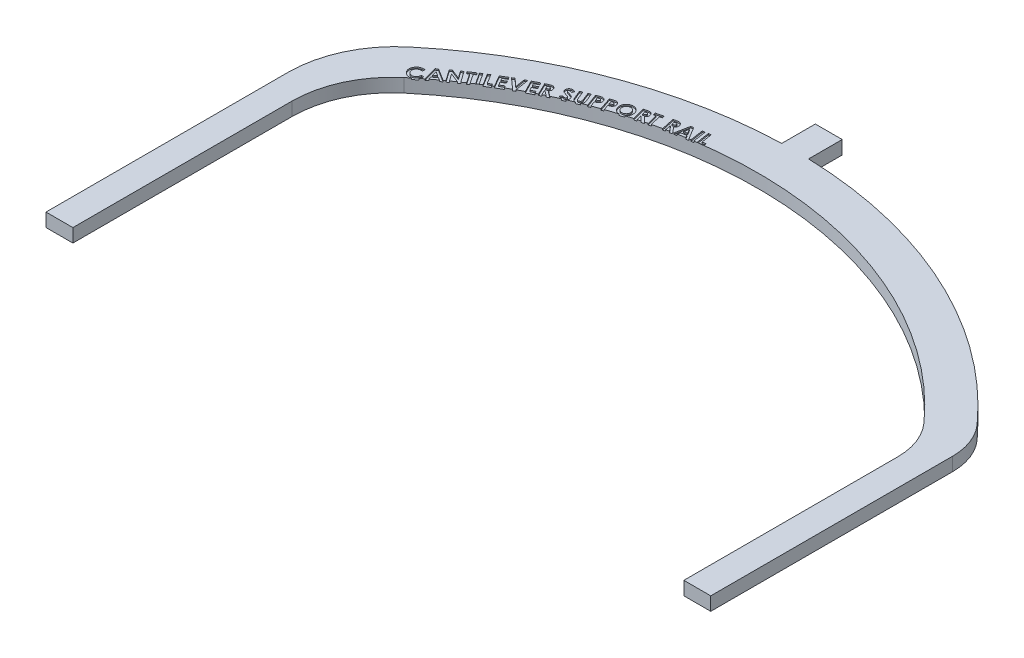
from build123d import *

# Parameters (mm, degrees)
BOSS_EXTRUDE1_DEPTH = 12.7
CUT_EXTRUDE1_DEPTH  = 1.27


with BuildPart() as part:
    # Sketch1 → Boss-Extrude1 (new body)
    with BuildSketch(Plane(origin=(0, 0, 0), x_dir=(1, 0, 0), z_dir=(0, 1, 0))):
        with BuildLine():
            Line((3082.646124993, 1003.879538559), (3082.646124993, 1035.629538559))
            Line((3082.646124993, 1035.629538559), (3108.046124993, 1035.629538559))
            Line((3108.046124993, 1035.629538559), (3108.046124993, 1003.879538559))
            ThreePointArc((3108.046124993, 1003.879538559), (3270.558337447, 965.432371177), (3404.910533494, 866.246226513))
            ThreePointArc((3404.910533494, 866.246226513), (3415.571618267, 848.848917341), (3419.28996032, 828.786538933))
            Line((3419.28996032, 828.786538933), (3419.28996032, 600.186538933))
            Line((3419.28996032, 600.186538933), (3393.88996032, 600.186538933))
            Line((3393.88996032, 600.186538933), (3393.88996032, 802.318834036))
            ThreePointArc((3393.88996032, 802.318834036), (3389.906247874, 823.813022954), (3378.4843035, 842.451942151))
            ThreePointArc((3378.4843035, 842.451942151), (3121.92334149, 967.585084278), (2850.444045703, 879.376113957))
            ThreePointArc((2850.444045703, 879.376113957), (2825.54601044, 846.928362669), (2816.693739446, 806.998348621))
            Line((2816.693739446, 806.998348621), (2816.693739446, 600.186538933))
            Line((2816.693739446, 600.186538933), (2791.293739446, 600.186538933))
            Line((2791.293739446, 600.186538933), (2791.293739446, 828.786538933))
            ThreePointArc((2791.293739446, 828.786538933), (2800.812868283, 871.724554326), (2827.586518302, 906.616654354))
            ThreePointArc((2827.586518302, 906.616654354), (2946.923030741, 976.733965122), (3082.646124993, 1003.879538559))
        make_face()
    extrude(amount=BOSS_EXTRUDE1_DEPTH)

    # Sketch2 → Cut-Extrude1 (cut)
    # profile 1 of 21: a face of its own
    with BuildSketch(Plane(origin=(0, 12.7, 0), x_dir=(1, 0, 0), z_dir=(0, 1, 0))):
        with BuildLine():
            Line((2854.036273267, 895.693782226), (2853.741161087, 893.386310271))
            add(Edge.make_bspline(
                [(2853.741161087, 893.386310271), (2853.538745508, 893.408701165), (2853.144041624, 893.452362689), (2852.559479317, 893.45392521), (2852.000754601, 893.403509429), (2851.465669887, 893.3028679), (2850.956689885, 893.146473251), (2850.472744452, 892.939354262), (2850.012673657, 892.680185207), (2849.732753638, 892.466247663), (2849.591782081, 892.358505784)],
                knots=[0, 0, 0, 0, 1.110178995, 2.164813411, 3.182023249, 4.16630837, 5.129066433, 6.080198176, 7.033161496, 8, 8, 8, 8], degree=3))
            add(Edge.make_bspline(
                [(2849.591782081, 892.358505784), (2849.478800227, 892.262175627), (2849.256650091, 892.072766827), (2848.960166138, 891.757246052), (2848.702050663, 891.423162975), (2848.482245031, 891.070295502), (2848.299070891, 890.699514008), (2848.16071286, 890.307611415), (2848.054861109, 889.898387637), (2847.990392677, 889.474813917), (2847.9635173, 889.047155908), (2847.982926331, 888.6255226), (2848.037245735, 888.213436389), (2848.137154548, 887.811529928), (2848.28187403, 887.421571349), (2848.461971928, 887.040100293), (2848.68815942, 886.671267945), (2848.865455354, 886.439488024), (2848.955764453, 886.321426457)],
                knots=[0, 0, 0, 0, 1.05173237, 2.067964735, 3.062219871, 4.039580069, 5.010003154, 5.987252451, 6.980034845, 8.001851189, 9.019433604, 10.012088621, 10.988801714, 11.961158804, 12.940457753, 13.932530269, 14.946894476, 16, 16, 16, 16], degree=3))
            add(Edge.make_bspline(
                [(2848.955764453, 886.321426457), (2849.022818476, 886.241871303), (2849.154823878, 886.085255645), (2849.364249603, 885.864792747), (2849.583230099, 885.664015852), (2849.809614247, 885.480981213), (2850.042984371, 885.314098253), (2850.283407066, 885.163653344), (2850.534052159, 885.033901702), (2850.790940904, 884.92232361), (2851.053041702, 884.827038562), (2851.319795453, 884.754625734), (2851.588961418, 884.697675655), (2851.860046021, 884.659390316), (2852.134731918, 884.641227173), (2852.410969118, 884.644771942), (2852.690700076, 884.664514589), (2852.97100911, 884.705725764), (2853.25142043, 884.764206489), (2853.527686315, 884.840248816), (2853.798813386, 884.933543665), (2854.06119875, 885.050922463), (2854.320849783, 885.178821402), (2854.574186741, 885.327584176), (2854.820366413, 885.495692896), (2854.979028808, 885.61845333), (2855.058989613, 885.680320688)],
                knots=[0, 0, 0, 0, 1.088887861, 2.143630938, 3.180177357, 4.196304021, 5.188936652, 6.181569282, 7.162183593, 8.140062349, 9.111514668, 10.07841455, 11.030658299, 11.989703728, 12.941492303, 13.909043844, 14.879157041, 15.874603407, 16.872105503, 17.875592508, 18.872146332, 19.869845871, 20.882088245, 21.900538373, 22.94193806, 24, 24, 24, 24], degree=3))
            add(Edge.make_bspline(
                [(2855.058989613, 885.680320688), (2855.189449224, 885.792226668), (2855.445729122, 886.012059098), (2855.782973305, 886.380705021), (2856.069304604, 886.773344178), (2856.273269306, 887.119581585), (2856.409175644, 887.416704141), (2856.502536253, 887.658249042), (2856.589167576, 887.9188653), (2856.668022451, 888.19798629), (2856.735750655, 888.496348161), (2856.796769486, 888.812824397), (2856.851074429, 889.148625112), (2856.87727083, 889.380118829), (2856.890720382, 889.498970527)],
                knots=[0, 0, 0, 0, 1.416939689, 2.783491055, 4.109936354, 5.420178514, 6.090036538, 6.803239493, 7.555382972, 8.354867369, 9.194857702, 10.078404074, 11.013429213, 12, 12, 12, 12], degree=3))
            Line((2856.890720382, 889.498970527), (2859.228721183, 889.201314277))
            add(Edge.make_bspline(
                [(2859.228721183, 889.201314277), (2859.208611224, 889.043425927), (2859.169158768, 888.733674762), (2859.092855575, 888.282191505), (2859.004457715, 887.854295621), (2858.90217443, 887.450364793), (2858.788363591, 887.068973826), (2858.661957917, 886.710246077), (2858.521697933, 886.375604663), (2858.367979269, 886.062059497), (2858.197235338, 885.764082064), (2858.012316609, 885.473201564), (2857.804799328, 885.190243609), (2857.578050624, 884.913331928), (2857.33332094, 884.641084162), (2857.071582778, 884.373062722), (2856.788391959, 884.113803445), (2856.58948768, 883.947881597), (2856.488757241, 883.863854341)],
                knots=[0, 0, 0, 0, 1.235582976, 2.424012065, 3.5538245, 4.626869192, 5.657909355, 6.64285172, 7.57824923, 8.473344072, 9.352017348, 10.243254057, 11.147934228, 12.074391944, 13.020822557, 13.989188457, 14.981671329, 16, 16, 16, 16], degree=3))
            add(Edge.make_bspline(
                [(2856.488757241, 883.863854341), (2856.298850394, 883.716863241), (2855.926063233, 883.428319695), (2855.332951481, 883.065986945), (2854.732347435, 882.764100719), (2854.118586173, 882.531038023), (2853.493591245, 882.365470102), (2852.857694572, 882.263901707), (2852.211234275, 882.235887222), (2851.560059684, 882.267463552), (2850.916707666, 882.366958877), (2850.291417761, 882.527195565), (2849.690752936, 882.751925741), (2849.115957253, 883.041634658), (2848.566415684, 883.392258577), (2848.042701873, 883.804824048), (2847.543071681, 884.279947023), (2847.240432662, 884.636027692), (2847.085872626, 884.817880784)],
                knots=[0, 0, 0, 0, 1.086400669, 2.132604632, 3.140358809, 4.125687137, 5.098742261, 6.062476536, 7.034796858, 8.022642088, 9.009136309, 9.976533535, 10.939839559, 11.906390961, 12.885063744, 13.885715185, 14.920218747, 16, 16, 16, 16], degree=3))
            add(Edge.make_bspline(
                [(2847.085872626, 884.817880784), (2846.990277858, 884.940613164), (2846.801583438, 885.182874492), (2846.546930657, 885.561149202), (2846.319342024, 885.945156513), (2846.123076578, 886.337172688), (2845.958452363, 886.7359762), (2845.816298162, 887.138397511), (2845.706746854, 887.549270221), (2845.629071816, 887.966188183), (2845.57681099, 888.386735733), (2845.557732698, 888.809323216), (2845.564128193, 889.232691117), (2845.603707129, 889.655817657), (2845.668975869, 890.0793849), (2845.767129818, 890.502156829), (2845.891800633, 890.926447245), (2846.046855704, 891.34824797), (2846.225949417, 891.763216344), (2846.429248639, 892.164342297), (2846.659880088, 892.546423863), (2846.911289857, 892.913262851), (2847.186580473, 893.262686332), (2847.486092768, 893.593644817), (2847.805618928, 893.911702266), (2848.037559229, 894.105397205), (2848.154382241, 894.202956906)],
                knots=[0, 0, 0, 0, 1.062251212, 2.096776656, 3.11195735, 4.109185054, 5.088010639, 6.056985029, 7.022161103, 7.988847885, 8.951500846, 9.914066686, 10.875673664, 11.841040878, 12.814212487, 13.800531958, 14.802993609, 15.832741368, 16.867801706, 17.888370809, 18.901533809, 19.913653309, 20.924047849, 21.937028728, 22.960928664, 24, 24, 24, 24], degree=3))
            add(Edge.make_bspline(
                [(2848.154382241, 894.202956906), (2848.257070855, 894.282857983), (2848.461324857, 894.441786167), (2848.781108644, 894.661540185), (2849.110658054, 894.861995342), (2849.451856641, 895.043337942), (2849.801127882, 895.208415597), (2850.161661617, 895.355091674), (2850.533344286, 895.477279466), (2850.911874213, 895.588365737), (2851.296651444, 895.676848569), (2851.684950107, 895.742908003), (2852.074711233, 895.788618475), (2852.465318722, 895.814887138), (2852.856875351, 895.816430723), (2853.249277663, 895.799309441), (2853.643382469, 895.758749151), (2853.905024197, 895.715485072), (2854.036273267, 895.693782226)],
                knots=[0, 0, 0, 0, 0.997702735, 1.984492435, 2.973850679, 3.954383721, 4.946474413, 5.935597484, 6.937193048, 7.945795584, 8.960231564, 9.963156526, 10.965089882, 11.968773709, 12.96386568, 13.966474278, 14.979909047, 16, 16, 16, 16], degree=3))
        make_face()
    # profile 2 of 21: a face of its own
    with BuildSketch(Plane(origin=(0, 12.7, 0), x_dir=(1, 0, 0), z_dir=(0, 1, 0))):
        Polygon((2857.711114458, 901.209431326), (2859.652240259, 902.672271871), (2871.100557567, 895.531065941), (2869.111094426, 894.032608409), (2866.765461413, 895.510713377), (2862.661875676, 892.417123634), (2863.402200195, 889.730585172), (2861.412737054, 888.22958357), align=None)
        Polygon((2860.705485452, 899.286114018), (2861.964800356, 894.823814339), (2864.638618465, 896.838718185), align=None, mode=Mode.SUBTRACT)
    # profile 3 of 21: a face of its own
    with BuildSketch(Plane(origin=(0, 12.7, 0), x_dir=(1, 0, 0), z_dir=(0, 1, 0))):
        Polygon((2865.459724374, 906.929901564), (2867.334704342, 908.242641948), (2876.490814117, 904.561371916), (2871.748666681, 911.333687622), (2873.707600976, 912.704941628), (2880.914952739, 902.414176404), (2879.03234056, 901.096347878), (2869.896583348, 904.762353487), (2874.626010431, 898.010390346), (2872.667076136, 896.63913634), align=None)
    # profile 4 of 21: a face of its own
    with BuildSketch(Plane(origin=(0, 12.7, 0), x_dir=(1, 0, 0), z_dir=(0, 1, 0))):
        Polygon((2875.35482158, 913.915525227), (2881.170566773, 917.764703913), (2882.475674946, 915.790505195), (2880.55998985, 914.521014009), (2886.21800267, 905.970393016), (2884.18529033, 904.627123785), (2878.52727751, 913.177744779), (2876.659929753, 911.941326509), align=None)
    # profile 5 of 21: a face of its own
    with BuildSketch(Plane(origin=(0, 12.7, 0), x_dir=(1, 0, 0), z_dir=(0, 1, 0))):
        Polygon((2882.359387948, 918.547041979), (2884.348851089, 919.864870505), (2891.311972083, 909.340050794), (2889.322508942, 908.022222268), align=None)
    # profile 6 of 21: a face of its own
    with BuildSketch(Plane(origin=(0, 12.7, 0), x_dir=(1, 0, 0), z_dir=(0, 1, 0))):
        Polygon((2886.992353002, 921.465287796), (2889.040329765, 922.7246027), (2894.456655887, 913.919574655), (2897.440850598, 915.756393565), (2898.64165188, 913.802547412), (2893.609480406, 910.706413597), align=None)
    # profile 7 of 21: a face of its own
    with BuildSketch(Plane(origin=(0, 12.7, 0), x_dir=(1, 0, 0), z_dir=(0, 1, 0))):
        Polygon((2893.931880696, 925.65261869), (2899.869741273, 929.122730869), (2901.052734062, 927.097650741), (2897.170482459, 924.828339844), (2898.320402331, 922.861773337), (2902.202653934, 925.131084235), (2903.365294158, 923.141621094), (2899.483042555, 920.872310196), (2901.154496882, 918.010230869), (2905.036748485, 920.279541767), (2906.224829414, 918.246829427), (2900.286968837, 914.776717247), align=None)
    # profile 8 of 21: a face of its own
    with BuildSketch(Plane(origin=(0, 12.7, 0), x_dir=(1, 0, 0), z_dir=(0, 1, 0))):
        Polygon((2901.248984263, 929.991620754), (2903.424164552, 931.182245754), (2910.539929776, 924.819525402), (2909.051648526, 934.263115145), (2911.226828815, 935.453740145), (2913.305334424, 922.153339504), (2911.264989872, 921.036492549), align=None)
    # profile 9 of 21: a face of its own
    with BuildSketch(Plane(origin=(0, 12.7, 0), x_dir=(1, 0, 0), z_dir=(0, 1, 0))):
        Polygon((2913.304923543, 936.4807051), (2919.433589408, 939.617544043), (2920.502099024, 937.526318081), (2916.495187966, 935.475797248), (2917.535712806, 933.445628979), (2921.542623863, 935.496149812), (2922.593324985, 933.443084908), (2918.586413927, 931.392564075), (2920.097591812, 928.438898209), (2924.10450287, 930.489419043), (2925.178100626, 928.39056087), (2919.049434761, 925.253721927), align=None)
    # profile 10 of 21: a face of its own
    with BuildSketch(Plane(origin=(0, 12.7, 0), x_dir=(1, 0, 0), z_dir=(0, 1, 0))):
        with BuildLine():
            Line((2921.885375085, 940.78402899), (2924.175038547, 941.880523381))
            add(Edge.make_bspline(
                [(2924.175038547, 941.880523381), (2924.326512196, 941.951605065), (2924.618610207, 942.088677212), (2925.04549082, 942.275355829), (2925.444945651, 942.432237814), (2925.813860536, 942.566951398), (2926.154799993, 942.670551391), (2926.465720204, 942.751979867), (2926.74900374, 942.803441619), (2927.086219571, 942.838396201), (2927.487127393, 942.826321818), (2927.954019693, 942.740026672), (2928.406277329, 942.572991491), (2928.766363452, 942.376841221), (2929.041412665, 942.185518902), (2929.240254831, 942.024714745), (2929.429696567, 941.848562319), (2929.607268791, 941.655353589), (2929.77375151, 941.445190664), (2929.927954751, 941.218307512), (2930.074332836, 940.977205335), (2930.159051435, 940.806732068), (2930.201941592, 940.720427227)],
                knots=[0, 0, 0, 0, 1.421347431, 2.740890973, 3.956872945, 5.066552961, 6.076028076, 6.982812744, 7.795303958, 8.519270897, 9.859650626, 11.1863324, 12.535414293, 13.937647829, 14.657048696, 15.379329193, 16.108189666, 16.852514192, 17.606295346, 18.383565237, 19.181653835, 20, 20, 20, 20], degree=3))
            add(Edge.make_bspline(
                [(2930.201941592, 940.720427227), (2930.243703977, 940.628451705), (2930.325850227, 940.447536647), (2930.428869677, 940.172949011), (2930.50414281, 939.899958488), (2930.560701469, 939.631551917), (2930.598412835, 939.366414082), (2930.606732229, 939.104085275), (2930.598055678, 938.845287196), (2930.563661234, 938.591070133), (2930.511600063, 938.339147075), (2930.430491303, 938.092516278), (2930.331659204, 937.846983466), (2930.209258801, 937.605197227), (2930.062901476, 937.367586925), (2929.894074832, 937.133407881), (2929.704004664, 936.901127126), (2929.561947683, 936.754908501), (2929.489601848, 936.680443253)],
                knots=[0, 0, 0, 0, 1.09685938, 2.157512906, 3.18092885, 4.168924605, 5.13535234, 6.084646377, 7.015535552, 7.94423547, 8.867255773, 9.8050891, 10.759373358, 11.739612572, 12.744166522, 13.786916756, 14.872935688, 16, 16, 16, 16], degree=3))
            Line((2929.489601848, 936.680443253), (2934.590463226, 932.922851106))
            Line((2934.590463226, 932.922851106), (2932.232109861, 931.793283798))
            Line((2932.232109861, 931.793283798), (2927.375479252, 935.372791009))
            Line((2927.375479252, 935.372791009), (2927.177041752, 935.27611633))
            Line((2927.177041752, 935.27611633), (2929.479425566, 930.472911202))
            Line((2929.479425566, 930.472911202), (2927.319509701, 929.440018574))
            Line((2927.319509701, 929.440018574), (2921.885375085, 940.78402899))
        make_face()
        with BuildLine():
            Line((2926.169589829, 937.382606715), (2926.846312585, 937.70824774))
            add(Edge.make_bspline(
                [(2926.846312585, 937.70824774), (2926.928914051, 937.749140673), (2927.087039931, 937.827422953), (2927.308959234, 937.950408129), (2927.508525941, 938.069391786), (2927.684401144, 938.188028972), (2927.834892497, 938.30727335), (2927.96040649, 938.425056609), (2928.06462838, 938.53885176), (2928.166386434, 938.691191184), (2928.248019209, 938.898118887), (2928.272631554, 939.168223854), (2928.222403513, 939.457355849), (2928.142910456, 939.64401288), (2928.100539348, 939.74350415)],
                knots=[0, 0, 0, 0, 1.204461837, 2.305728933, 3.315037427, 4.240341522, 5.076376077, 5.821267787, 6.488569286, 7.087989011, 8.207619199, 9.354564099, 10.589939122, 12, 12, 12, 12], degree=3))
            add(Edge.make_bspline(
                [(2928.100539348, 939.74350415), (2928.070126913, 939.802277481), (2928.010506193, 939.91749707), (2927.891931049, 940.068368144), (2927.755084292, 940.195025818), (2927.602079599, 940.29706845), (2927.436047999, 940.373046971), (2927.262281274, 940.425073705), (2927.080232871, 940.447839013), (2926.922621323, 940.44401527), (2926.787149352, 940.422838571), (2926.668941902, 940.397002456), (2926.535520863, 940.358915045), (2926.387197079, 940.30721719), (2926.224975083, 940.242744212), (2926.046242255, 940.1695305), (2925.853562321, 940.082234037), (2925.720077844, 940.020083926), (2925.650599444, 939.98773492)],
                knots=[0, 0, 0, 0, 1.126759185, 2.208905474, 3.252969622, 4.296031307, 5.331543593, 6.356801521, 7.377662472, 8.448438402, 9.033497815, 9.714413281, 10.511152342, 11.398580344, 12.392440594, 13.488419245, 14.692727319, 16, 16, 16, 16], degree=3))
            Line((2925.650599444, 939.98773492), (2925.057831015, 939.702799022))
            Line((2925.057831015, 939.702799022), (2926.169589829, 937.382606715))
        make_face(mode=Mode.SUBTRACT)
    # profile 11 of 21: a face of its own
    with BuildSketch(Plane(origin=(0, 12.7, 0), x_dir=(1, 0, 0), z_dir=(0, 1, 0))):
        with BuildLine():
            Line((2942.632065213, 948.413210693), (2941.62715736, 946.26855925))
            add(Edge.make_bspline(
                [(2941.62715736, 946.26855925), (2941.516332238, 946.333441232), (2941.30325794, 946.458184454), (2940.978799689, 946.603758744), (2940.672231774, 946.719493902), (2940.379543988, 946.79418408), (2940.10188323, 946.830786202), (2939.838906341, 946.833009091), (2939.589928904, 946.793502437), (2939.435988933, 946.73661856), (2939.360390533, 946.708683449)],
                knots=[0, 0, 0, 0, 1.285923329, 2.472338456, 3.558439413, 4.566258642, 5.491680341, 6.358437637, 7.193844932, 8, 8, 8, 8], degree=3))
            add(Edge.make_bspline(
                [(2939.360390533, 946.708683449), (2939.292145518, 946.676119828), (2939.160872946, 946.613482135), (2938.990123532, 946.486760049), (2938.852233946, 946.339178449), (2938.748708978, 946.174763307), (2938.680052774, 946.004428567), (2938.648123188, 945.836968248), (2938.649208531, 945.674191639), (2938.685783989, 945.57509819), (2938.704020341, 945.525690661)],
                knots=[0, 0, 0, 0, 1.211194244, 2.329790441, 3.388949082, 4.434735749, 5.430358932, 6.316451936, 7.160590829, 8, 8, 8, 8], degree=3))
            add(Edge.make_bspline(
                [(2938.704020341, 945.525690661), (2938.726900312, 945.478835523), (2938.772632834, 945.385181401), (2938.873345688, 945.262176062), (2938.993015701, 945.150558842), (2939.087854438, 945.09247188), (2939.136512328, 945.062669827)],
                knots=[0, 0, 0, 0, 0.967791811, 1.93442374, 2.940237024, 4, 4, 4, 4], degree=3))
            add(Edge.make_bspline(
                [(2939.136512328, 945.062669827), (2939.178701678, 945.041028732), (2939.275989736, 944.991124665), (2939.447583265, 944.918038563), (2939.665181294, 944.838275118), (2939.92534076, 944.744428114), (2940.229662046, 944.639663429), (2940.57834377, 944.525524312), (2940.97199936, 944.401351936), (2941.249723238, 944.31620331), (2941.395646943, 944.271463898)],
                knots=[0, 0, 0, 0, 0.474857838, 1.09501563, 1.86652153, 2.796195678, 3.865357899, 5.0902776, 6.471152436, 8, 8, 8, 8], degree=3))
            add(Edge.make_bspline(
                [(2941.395646943, 944.271463898), (2941.532145898, 944.230650939), (2941.790746746, 944.153329718), (2942.158807122, 944.045080805), (2942.482948529, 943.942843842), (2942.765881489, 943.852878494), (2943.008833365, 943.778676033), (2943.208663412, 943.708240841), (2943.369285538, 943.654629271), (2943.460706175, 943.617967826), (2943.499593257, 943.602373353)],
                knots=[0, 0, 0, 0, 1.548386444, 2.933458709, 4.169421886, 5.242096298, 6.160275906, 6.929723018, 7.544742302, 8, 8, 8, 8], degree=3))
            add(Edge.make_bspline(
                [(2943.499593257, 943.602373353), (2943.652446994, 943.537670488), (2943.945095015, 943.413792815), (2944.349710026, 943.199158279), (2944.702522022, 942.971509482), (2945.007388119, 942.725309028), (2945.270794217, 942.456887328), (2945.500309952, 942.161509491), (2945.704539668, 941.839406244), (2945.812982719, 941.606617279), (2945.868122905, 941.488250757)],
                knots=[0, 0, 0, 0, 1.218740014, 2.333353836, 3.359597961, 4.29837092, 5.20574517, 6.115361567, 7.041715329, 8, 8, 8, 8], degree=3))
            add(Edge.make_bspline(
                [(2945.868122905, 941.488250757), (2945.915105089, 941.370267792), (2946.007094922, 941.13926037), (2946.108384596, 940.785409588), (2946.166060702, 940.432717321), (2946.189210956, 940.08257063), (2946.178337591, 939.734184097), (2946.121982503, 939.388509163), (2946.034321194, 939.044275135), (2945.905377711, 938.706953266), (2945.747328902, 938.379058765), (2945.552706193, 938.071591756), (2945.329936005, 937.783249749), (2945.073623102, 937.517676581), (2944.784798022, 937.273325592), (2944.465057525, 937.049504027), (2944.116270346, 936.843962623), (2943.866229651, 936.73028738), (2943.738735886, 936.672325276)],
                knots=[0, 0, 0, 0, 1.031518925, 2.019685862, 2.983724988, 3.929791433, 4.867565412, 5.809003127, 6.770008387, 7.749100081, 8.738347573, 9.722952322, 10.700199419, 11.694378456, 12.71609211, 13.769474433, 14.86267272, 16, 16, 16, 16], degree=3))
            add(Edge.make_bspline(
                [(2943.738735886, 936.672325276), (2943.63665293, 936.630238469), (2943.434873454, 936.547048734), (2943.127909025, 936.448162538), (2942.822298116, 936.374813251), (2942.51935343, 936.319011348), (2942.217073578, 936.293347578), (2941.916998031, 936.283368749), (2941.619197437, 936.302280162), (2941.322558607, 936.343511075), (2941.025659804, 936.405850715), (2940.73011512, 936.500313325), (2940.431782252, 936.61367094), (2940.13324625, 936.755432687), (2939.832947692, 936.920485198), (2939.532360886, 937.113112087), (2939.229030767, 937.328379786), (2939.032988087, 937.488635635), (2938.932986687, 937.570382167)],
                knots=[0, 0, 0, 0, 1.021323989, 2.018772067, 2.979758655, 3.927847242, 4.865489691, 5.78376166, 6.70337339, 7.622114498, 8.553135538, 9.506081333, 10.489607957, 11.50394654, 12.560932203, 13.657928141, 14.805308807, 16, 16, 16, 16], degree=3))
            Line((2938.932986687, 937.570382167), (2940.296608482, 939.488611334))
            add(Edge.make_bspline(
                [(2940.296608482, 939.488611334), (2940.418241277, 939.397671752), (2940.651505474, 939.223270198), (2941.007657541, 939.002824585), (2941.351612867, 938.834698989), (2941.684151864, 938.720818502), (2942.003144627, 938.653464072), (2942.311704713, 938.643602134), (2942.608506338, 938.681053664), (2942.792470565, 938.749750994), (2942.883928193, 938.783903802)],
                knots=[0, 0, 0, 0, 1.293882523, 2.481374106, 3.564275724, 4.549349188, 5.470662853, 6.331206692, 7.170361108, 8, 8, 8, 8], degree=3))
            add(Edge.make_bspline(
                [(2942.883928193, 938.783903802), (2942.974015718, 938.827372604), (2943.14818825, 938.911413889), (2943.373004562, 939.087241763), (2943.560470017, 939.289060253), (2943.698049091, 939.521079978), (2943.793374547, 939.762457729), (2943.836879591, 940.004969819), (2943.822849518, 940.242084494), (2943.771918388, 940.387497745), (2943.746368097, 940.46044627)],
                knots=[0, 0, 0, 0, 1.147907326, 2.219329753, 3.262250237, 4.299725102, 5.303574411, 6.233938217, 7.11403121, 8, 8, 8, 8], degree=3))
            add(Edge.make_bspline(
                [(2943.746368097, 940.46044627), (2943.714817219, 940.524655615), (2943.650462865, 940.655623474), (2943.506105655, 940.828971566), (2943.32642747, 940.985617925), (2943.148909585, 941.104081756), (2942.978044737, 941.193154044), (2942.821088912, 941.266332007), (2942.63689352, 941.342653848), (2942.4255015, 941.421265825), (2942.185676219, 941.501690988), (2941.919018043, 941.588934401), (2941.624041461, 941.676611515), (2941.418563692, 941.736795968), (2941.311692616, 941.768098513)],
                knots=[0, 0, 0, 0, 0.90164922, 1.839094721, 2.826266732, 3.908381705, 4.526918894, 5.260585068, 6.096646716, 7.046329418, 8.110673762, 9.293674922, 10.592412834, 12, 12, 12, 12], degree=3))
            add(Edge.make_bspline(
                [(2941.311692616, 941.768098513), (2941.107096485, 941.826703775), (2940.712973653, 941.939597755), (2940.149425044, 942.114159731), (2939.638039321, 942.286810731), (2939.178600691, 942.455594537), (2938.768925464, 942.615641985), (2938.41224129, 942.77673477), (2938.104819639, 942.929881774), (2937.845670158, 943.085473039), (2937.620070532, 943.242567689), (2937.417845626, 943.405047478), (2937.230590662, 943.572925042), (2937.062259642, 943.748988851), (2936.911093621, 943.93232396), (2936.779879207, 944.124276233), (2936.659460357, 944.320330818), (2936.596149021, 944.459000594), (2936.56445704, 944.52841502)],
                knots=[0, 0, 0, 0, 1.800203091, 3.467813079, 4.989914488, 6.365161938, 7.607959434, 8.709212944, 9.674836401, 10.511375378, 11.263576701, 11.998477362, 12.704415329, 13.389339833, 14.057070021, 14.711726029, 15.355124095, 16, 16, 16, 16], degree=3))
            add(Edge.make_bspline(
                [(2936.56445704, 944.52841502), (2936.525291732, 944.628681034), (2936.44808678, 944.826331289), (2936.365493434, 945.131108863), (2936.319842139, 945.437663495), (2936.307908637, 945.745416371), (2936.324290105, 946.055227242), (2936.379715682, 946.366968773), (2936.466112329, 946.680657809), (2936.586713313, 946.991353989), (2936.730502669, 947.295118647), (2936.908522001, 947.577806033), (2937.107310847, 947.841948571), (2937.331694201, 948.084782957), (2937.583030719, 948.303535463), (2937.857223674, 948.503848562), (2938.156946907, 948.682370115), (2938.371461732, 948.780647592), (2938.480142136, 948.830438257)],
                knots=[0, 0, 0, 0, 0.985718607, 1.943106389, 2.885849543, 3.818971467, 4.760625522, 5.722416556, 6.713874654, 7.736884896, 8.772386713, 9.787816365, 10.791617493, 11.797701083, 12.810690582, 13.839437623, 14.905386656, 16, 16, 16, 16], degree=3))
            add(Edge.make_bspline(
                [(2938.480142136, 948.830438257), (2938.625595366, 948.887726475), (2938.914584019, 949.001547564), (2939.369693791, 949.103515008), (2939.832906922, 949.154747052), (2940.228084086, 949.154024902), (2940.552946958, 949.11996811), (2940.812232638, 949.076376438), (2941.083626846, 949.011769295), (2941.368734391, 948.929948425), (2941.66706326, 948.830845896), (2941.97808464, 948.709932773), (2942.302318345, 948.570919755), (2942.520486949, 948.466575577), (2942.632065213, 948.413210693)],
                knots=[0, 0, 0, 0, 1.300834844, 2.584518128, 3.871134084, 5.178247273, 5.86722082, 6.590861324, 7.367216959, 8.190204084, 9.06156832, 9.985296664, 10.969617558, 12, 12, 12, 12], degree=3))
        make_face()
    # profile 12 of 21: a face of its own
    with BuildSketch(Plane(origin=(0, 12.7, 0), x_dir=(1, 0, 0), z_dir=(0, 1, 0))):
        with BuildLine():
            Line((2944.488794514, 951.041325614), (2946.722488425, 951.939382505))
            Line((2946.722488425, 951.939382505), (2949.765196758, 944.370772729))
            add(Edge.make_bspline(
                [(2949.765196758, 944.370772729), (2949.796718386, 944.292449299), (2949.857436133, 944.141580756), (2949.956369775, 943.928733246), (2950.045126491, 943.732298792), (2950.137856906, 943.557871273), (2950.229321908, 943.404339877), (2950.314769824, 943.267427187), (2950.401267883, 943.152947287), (2950.512483077, 943.027688747), (2950.661279594, 942.896941976), (2950.862466423, 942.779181248), (2951.079140979, 942.683741236), (2951.316650002, 942.62675224), (2951.567783012, 942.603769793), (2951.829361778, 942.619697354), (2952.096983862, 942.676623522), (2952.272630308, 942.740396798), (2952.362692751, 942.773096447)],
                knots=[0, 0, 0, 0, 1.150814686, 2.216727933, 3.199451389, 4.089007301, 4.907914043, 5.635918424, 6.28798844, 6.861184684, 7.918346598, 8.971200786, 10.027793568, 11.135402434, 12.284706177, 13.454471515, 14.694784218, 16, 16, 16, 16], degree=3))
            add(Edge.make_bspline(
                [(2952.362692751, 942.773096447), (2952.456231369, 942.81498805), (2952.637865647, 942.896333608), (2952.885719062, 943.052091063), (2953.095860158, 943.23759851), (2953.272163633, 943.444185781), (2953.412239038, 943.665844983), (2953.509910825, 943.898432565), (2953.570465716, 944.135033482), (2953.585424692, 944.340162275), (2953.575289485, 944.515652384), (2953.550768918, 944.669399767), (2953.512569126, 944.844373187), (2953.457336707, 945.040561033), (2953.392245666, 945.25918025), (2953.309448591, 945.498836077), (2953.213430534, 945.760354558), (2953.140837008, 945.940659612), (2953.103017271, 946.034594844)],
                knots=[0, 0, 0, 0, 1.269484493, 2.46509844, 3.612178147, 4.730677556, 5.821519609, 6.848446198, 7.845288548, 8.836127108, 9.383645964, 10.021405693, 10.763655889, 11.602620998, 12.547040094, 13.590828915, 14.744871306, 16, 16, 16, 16], degree=3))
            Line((2953.103017271, 946.034594844), (2950.17224804, 953.325900934))
            Line((2950.17224804, 953.325900934), (2952.40594195, 954.223957825))
            Line((2952.40594195, 954.223957825), (2955.209507655, 947.250660549))
            add(Edge.make_bspline(
                [(2955.209507655, 947.250660549), (2955.266021738, 947.109252845), (2955.37462093, 946.837519469), (2955.522216351, 946.443107578), (2955.649656244, 946.08012476), (2955.756616135, 945.748217097), (2955.84692295, 945.44848246), (2955.916157433, 945.178683665), (2955.965639345, 944.940199225), (2956.003485389, 944.66294737), (2956.016558372, 944.329446554), (2955.981332337, 943.926874909), (2955.902553837, 943.511003499), (2955.771552254, 943.093050354), (2955.607298808, 942.681531072), (2955.391359404, 942.30035245), (2955.146629953, 941.946477905), (2954.856448829, 941.628297869), (2954.528395271, 941.337327164), (2954.152130596, 941.078888957), (2953.734879178, 940.839389364), (2953.431853945, 940.710166295), (2953.276014066, 940.643709428)],
                knots=[0, 0, 0, 0, 1.153653701, 2.216896281, 3.190150188, 4.067851274, 4.858595912, 5.56134554, 6.177468462, 6.702635559, 7.679931174, 8.69844385, 9.758108967, 10.879928467, 12.012148972, 13.107910715, 14.191608797, 15.265108626, 16.362056269, 17.506279767, 18.717529048, 20, 20, 20, 20], degree=3))
            add(Edge.make_bspline(
                [(2953.276014066, 940.643709428), (2953.171377525, 940.603210263), (2952.964363085, 940.523086131), (2952.649319027, 940.430499825), (2952.337713015, 940.357818958), (2952.028907346, 940.310229503), (2951.723930986, 940.281145119), (2951.421138457, 940.276140285), (2951.121754406, 940.293741276), (2950.826682207, 940.334372872), (2950.541178382, 940.396852155), (2950.265037792, 940.469095736), (2950.002552274, 940.559990405), (2949.755396275, 940.67212244), (2949.51737723, 940.791533178), (2949.295583272, 940.934264098), (2949.084312869, 941.088074113), (2948.882636012, 941.262629794), (2948.689142074, 941.46846651), (2948.494652075, 941.7122417), (2948.301198546, 942.000580394), (2948.101500167, 942.330276159), (2947.902746145, 942.704249413), (2947.698907617, 943.119894612), (2947.492896363, 943.57816243), (2947.360919076, 943.900554056), (2947.292360219, 944.068028338)],
                knots=[0, 0, 0, 0, 1.018780023, 2.015569081, 2.979769836, 3.923255415, 4.851492571, 5.760578771, 6.67113237, 7.573141822, 8.462998318, 9.324393689, 10.164869824, 10.982188284, 11.788359392, 12.581208734, 13.374656567, 14.160892453, 14.999990785, 15.93713454, 16.990449527, 18.151664513, 19.437168079, 20.835832647, 22.356295218, 24, 24, 24, 24], degree=3))
            Line((2947.292360219, 944.068028338), (2944.488794514, 951.041325614))
        make_face()
    # profile 13 of 21: a face of its own
    with BuildSketch(Plane(origin=(0, 12.7, 0), x_dir=(1, 0, 0), z_dir=(0, 1, 0))):
        with BuildLine():
            Line((2955.326409874, 955.341878431), (2957.712748015, 956.224670899))
            add(Edge.make_bspline(
                [(2957.712748015, 956.224670899), (2957.868404696, 956.281730762), (2958.168855905, 956.391868693), (2958.608989392, 956.533360023), (2959.01858708, 956.653501065), (2959.398162482, 956.752161352), (2959.74907895, 956.823120853), (2960.069948202, 956.872741411), (2960.361377794, 956.899168798), (2960.627901165, 956.903731941), (2960.875851002, 956.880551977), (2961.114645373, 956.847192291), (2961.345921282, 956.788779744), (2961.573508822, 956.719767762), (2961.792898686, 956.626049988), (2962.006935008, 956.517427456), (2962.2136501, 956.388574182), (2962.414863095, 956.244929286), (2962.604073035, 956.080931511), (2962.787124951, 955.906034826), (2962.954089822, 955.710891169), (2963.112407393, 955.502659962), (2963.258292622, 955.277549505), (2963.389126344, 955.036082052), (2963.510392083, 954.779767521), (2963.579632181, 954.601172166), (2963.614991605, 954.509967373)],
                knots=[0, 0, 0, 0, 1.686368885, 3.255058277, 4.701955097, 6.028501221, 7.243265888, 8.342538964, 9.329777341, 10.218385687, 11.049434788, 11.86077241, 12.668432562, 13.473323585, 14.277613374, 15.091698196, 15.91288273, 16.753282263, 17.603848555, 18.457951157, 19.32631211, 20.213159921, 21.117664584, 22.051957786, 23.005176902, 24, 24, 24, 24], degree=3))
            add(Edge.make_bspline(
                [(2963.614991605, 954.509967373), (2963.650638977, 954.408726308), (2963.72087188, 954.209259885), (2963.794712197, 953.90649008), (2963.851172177, 953.611283927), (2963.875182649, 953.320693041), (2963.879015739, 953.035675267), (2963.856108472, 952.755411235), (2963.807457565, 952.481178034), (2963.73351057, 952.213929058), (2963.63574636, 951.955458392), (2963.522426578, 951.703732849), (2963.383117757, 951.465569284), (2963.228460299, 951.23400011), (2963.048858696, 951.016614698), (2962.852567614, 950.805757318), (2962.633539065, 950.608059728), (2962.476047631, 950.485955561), (2962.396381829, 950.42419013)],
                knots=[0, 0, 0, 0, 1.116512027, 2.19976607, 3.240318441, 4.241645183, 5.230286479, 6.204479212, 7.163721604, 8.125235547, 9.086019934, 10.037883271, 10.9947673, 11.954456313, 12.933236888, 13.926124674, 14.950946487, 16, 16, 16, 16], degree=3))
            add(Edge.make_bspline(
                [(2962.396381829, 950.42419013), (2962.342523332, 950.387083852), (2962.225411238, 950.30639846), (2962.026284355, 950.190500158), (2961.791100833, 950.069309155), (2961.521792539, 949.939280013), (2961.215528122, 949.805487756), (2960.874496808, 949.663219), (2960.498414931, 949.512642284), (2960.234150439, 949.414445802), (2960.096542085, 949.363312726)],
                knots=[0, 0, 0, 0, 0.618127389, 1.344081192, 2.175978237, 3.119002851, 4.170673796, 5.334963185, 6.612256508, 8, 8, 8, 8], degree=3))
            Line((2960.096542085, 949.363312726), (2961.946081348, 944.361670098))
            Line((2961.946081348, 944.361670098), (2959.697123015, 943.52975904))
            Line((2959.697123015, 943.52975904), (2955.326409874, 955.341878431))
        make_face()
        with BuildLine():
            Line((2959.284983592, 951.556301508), (2959.999867406, 951.820884841))
            add(Edge.make_bspline(
                [(2959.999867406, 951.820884841), (2960.1293225, 951.869499594), (2960.366803392, 951.958681676), (2960.684364126, 952.100435921), (2960.932390735, 952.233845131), (2961.122656636, 952.360329904), (2961.257685324, 952.497947693), (2961.364956918, 952.640250564), (2961.447028511, 952.795363195), (2961.500254984, 952.963471515), (2961.528935362, 953.140147745), (2961.527779431, 953.32452738), (2961.500761905, 953.515434626), (2961.458848047, 953.639577674), (2961.437267246, 953.703497021)],
                knots=[0, 0, 0, 0, 1.830136425, 3.357321966, 4.598017425, 5.557100676, 6.366663034, 7.136663688, 7.909848369, 8.676569619, 9.460836761, 10.268997278, 11.108733305, 12, 12, 12, 12], degree=3))
            add(Edge.make_bspline(
                [(2961.437267246, 953.703497021), (2961.415790015, 953.758435691), (2961.374370438, 953.864386806), (2961.290527628, 954.008665964), (2961.197148292, 954.137133818), (2961.089297134, 954.246652673), (2960.970770679, 954.341145443), (2960.837655352, 954.413646783), (2960.69350082, 954.471650398), (2960.591374247, 954.493644933), (2960.539210355, 954.504879232)],
                knots=[0, 0, 0, 0, 1.11764165, 2.155410389, 3.156224186, 4.123360966, 5.063210716, 6.021203061, 6.989276277, 8, 8, 8, 8], degree=3))
            add(Edge.make_bspline(
                [(2960.539210355, 954.504879232), (2960.496891336, 954.511041148), (2960.406672283, 954.524177611), (2960.26064402, 954.521772828), (2960.098160119, 954.506651531), (2959.917815846, 954.473365711), (2959.71817425, 954.432597637), (2959.502104562, 954.368440749), (2959.267282234, 954.29594483), (2959.106660452, 954.23762125), (2959.022944329, 954.207222982)],
                knots=[0, 0, 0, 0, 0.656932028, 1.400499986, 2.239044201, 3.165518444, 4.219668417, 5.371850055, 6.630207433, 8, 8, 8, 8], degree=3))
            Line((2959.022944329, 954.207222982), (2958.389470771, 953.973168495))
            Line((2958.389470771, 953.973168495), (2959.284983592, 951.556301508))
        make_face(mode=Mode.SUBTRACT)
    # profile 14 of 21: a face of its own
    with BuildSketch(Plane(origin=(0, 12.7, 0), x_dir=(1, 0, 0), z_dir=(0, 1, 0))):
        with BuildLine():
            Line((2964.785852105, 958.820891651), (2967.19508688, 959.645170497))
            add(Edge.make_bspline(
                [(2967.19508688, 959.645170497), (2967.352519343, 959.697845478), (2967.656009307, 959.799389516), (2968.100126096, 959.931108277), (2968.512511112, 960.044474983), (2968.896252783, 960.13162551), (2969.248506847, 960.195653439), (2969.571119123, 960.237733238), (2969.863548492, 960.256785783), (2970.130753161, 960.252135493), (2970.379088062, 960.226093041), (2970.615985206, 960.182059678), (2970.847260006, 960.124521685), (2971.070750615, 960.04501718), (2971.288249304, 959.947539935), (2971.499520172, 959.8332776), (2971.703545371, 959.700373614), (2971.899983831, 959.549776219), (2972.086502311, 959.382609297), (2972.264584441, 959.201567346), (2972.425327206, 959.001573215), (2972.580816584, 958.791127908), (2972.716681333, 958.560069296), (2972.843107781, 958.315985189), (2972.963134943, 958.058682952), (2973.026765193, 957.877648309), (2973.059169412, 957.785454953)],
                knots=[0, 0, 0, 0, 1.687184391, 3.252464711, 4.707680245, 6.033356432, 7.250648261, 8.345388057, 9.33843026, 10.226374883, 11.058294833, 11.873162291, 12.673820267, 13.477996413, 14.28050798, 15.094280677, 15.91668034, 16.752786862, 17.607435755, 18.460779773, 19.330422137, 20.213164243, 21.117810442, 22.050756386, 23.007331922, 24, 24, 24, 24], degree=3))
            add(Edge.make_bspline(
                [(2973.059169412, 957.785454953), (2973.092174063, 957.682450375), (2973.156769157, 957.480854834), (2973.224248713, 957.176737875), (2973.271604365, 956.880377877), (2973.293138445, 956.589194186), (2973.284217721, 956.303141019), (2973.253793843, 956.023293187), (2973.202025665, 955.748999322), (2973.118032172, 955.484712367), (2973.017219922, 955.227353151), (2972.894251437, 954.979950895), (2972.752436494, 954.742571524), (2972.586802656, 954.518691284), (2972.407692036, 954.300308607), (2972.202860303, 954.098309628), (2971.980008795, 953.905501689), (2971.82018777, 953.787669879), (2971.738796816, 953.727662485)],
                knots=[0, 0, 0, 0, 1.124528991, 2.200873346, 3.236321832, 4.24435652, 5.232631164, 6.208666518, 7.17048876, 8.130286537, 9.088502263, 10.043138597, 11.00070452, 11.960502297, 12.937414127, 13.935364336, 14.948557214, 16, 16, 16, 16], degree=3))
            add(Edge.make_bspline(
                [(2971.738796816, 953.727662485), (2971.684283891, 953.691027341), (2971.565794098, 953.611396857), (2971.360272274, 953.505982079), (2971.123288483, 953.388060236), (2970.851149133, 953.262407617), (2970.540347538, 953.138318895), (2970.196290597, 953.001424151), (2969.815672309, 952.863123328), (2969.54932101, 952.770740369), (2969.410972297, 952.722754632)],
                knots=[0, 0, 0, 0, 0.619743065, 1.34707921, 2.177965391, 3.12041775, 4.176285136, 5.337721592, 6.617154139, 8, 8, 8, 8], degree=3))
            Line((2969.410972297, 952.722754632), (2971.140940246, 947.670230594))
            Line((2971.140940246, 947.670230594), (2968.869085278, 946.891745017))
            Line((2968.869085278, 946.891745017), (2964.785852105, 958.820891651))
        make_face()
        with BuildLine():
            Line((2968.652839284, 954.936095978), (2969.37535531, 955.182870818))
            add(Edge.make_bspline(
                [(2969.37535531, 955.182870818), (2969.505581133, 955.229103725), (2969.745064718, 955.314125437), (2970.065851512, 955.447794202), (2970.31918775, 955.572398636), (2970.509284861, 955.698227216), (2970.652346473, 955.82922803), (2970.761765057, 955.970170432), (2970.84860792, 956.123012454), (2970.906230572, 956.289510538), (2970.939860371, 956.466059974), (2970.944980424, 956.650765267), (2970.918562251, 956.841992974), (2970.880669305, 956.96754535), (2970.861092489, 957.032410081)],
                knots=[0, 0, 0, 0, 1.826165971, 3.358295321, 4.591438027, 5.552042891, 6.361078696, 7.143591845, 7.901308757, 8.674128965, 9.461124631, 10.268450493, 11.10542121, 12, 12, 12, 12], degree=3))
            add(Edge.make_bspline(
                [(2970.861092489, 957.032410081), (2970.839923547, 957.087034259), (2970.798744123, 957.193293333), (2970.724119388, 957.342465152), (2970.630123377, 957.470998199), (2970.526117197, 957.583040208), (2970.410165659, 957.680290805), (2970.278875406, 957.754558689), (2970.137851062, 957.819513489), (2970.035720887, 957.842411593), (2969.983388162, 957.854144856)],
                knots=[0, 0, 0, 0, 1.112771927, 2.164647914, 3.157121701, 4.125912928, 5.064364492, 6.017494183, 6.984140284, 8, 8, 8, 8], degree=3))
            add(Edge.make_bspline(
                [(2969.983388162, 957.854144856), (2969.941089364, 957.860911829), (2969.851006276, 957.875323345), (2969.704915571, 957.880285319), (2969.542080593, 957.864035939), (2969.359655078, 957.843403529), (2969.160736003, 957.800311701), (2968.942473872, 957.746902521), (2968.706479192, 957.678203068), (2968.544086268, 957.623267557), (2968.459489925, 957.594649664)],
                knots=[0, 0, 0, 0, 0.658258816, 1.401883501, 2.238859633, 3.171966861, 4.222883335, 5.364436582, 6.627039768, 8, 8, 8, 8], degree=3))
            Line((2968.459489925, 957.594649664), (2967.818384156, 957.3758596))
            Line((2967.818384156, 957.3758596), (2968.652839284, 954.936095978))
        make_face(mode=Mode.SUBTRACT)
    # profile 15 of 21: a face of its own
    with BuildSketch(Plane(origin=(0, 12.7, 0), x_dir=(1, 0, 0), z_dir=(0, 1, 0))):
        with BuildLine():
            add(Edge.make_bspline(
                [(2980.054522759, 964.097034345), (2980.26555757, 964.155506773), (2980.681891201, 964.270862329), (2981.317339736, 964.369415651), (2981.947196283, 964.402600821), (2982.57317641, 964.372784577), (2983.192787228, 964.274797002), (2983.808302579, 964.113324253), (2984.417552163, 963.884654591), (2985.015206524, 963.596802926), (2985.586597356, 963.256593446), (2986.115963247, 962.868466353), (2986.596973312, 962.437468925), (2987.02584992, 961.961858159), (2987.405744387, 961.443887496), (2987.733197274, 960.882364664), (2988.01418371, 960.278715596), (2988.156373042, 959.853391511), (2988.228621317, 959.637278736)],
                knots=[0, 0, 0, 0, 1.014422571, 2.001272827, 2.973555327, 3.933860434, 4.900684367, 5.876068937, 6.878586004, 7.91238956, 8.947209008, 9.956722456, 10.950438384, 11.93568238, 12.920047703, 13.922557063, 14.944423853, 16, 16, 16, 16], degree=3))
            add(Edge.make_bspline(
                [(2988.228621317, 959.637278736), (2988.289880153, 959.419512028), (2988.410267465, 958.991551748), (2988.512291458, 958.340568873), (2988.555631412, 957.699163106), (2988.529144359, 957.064837178), (2988.439948279, 956.438313926), (2988.28578145, 955.819767163), (2988.069103243, 955.209008591), (2987.786663976, 954.615828828), (2987.455025277, 954.050419591), (2987.076505269, 953.528317312), (2986.657577988, 953.054153449), (2986.195438916, 952.63040401), (2985.691588896, 952.256740283), (2985.145254415, 951.935350129), (2984.558586824, 951.660298001), (2984.144385565, 951.521090302), (2983.934230291, 951.450459826)],
                knots=[0, 0, 0, 0, 1.054003203, 2.071351998, 3.065852522, 4.047273139, 5.025869885, 6.011741124, 7.014765524, 8.042428094, 9.070501367, 10.067067136, 11.044632817, 12.015747649, 12.985315632, 13.963872434, 14.966920216, 16, 16, 16, 16], degree=3))
            add(Edge.make_bspline(
                [(2983.934230291, 951.450459826), (2983.711358292, 951.388481184), (2983.273173555, 951.266626062), (2982.608091613, 951.160415991), (2981.95438202, 951.121354095), (2981.310676073, 951.149447255), (2980.677564418, 951.24306626), (2980.055625403, 951.407032844), (2979.446433049, 951.642026083), (2978.85415522, 951.937694827), (2978.290718492, 952.285345638), (2977.7718611, 952.679063213), (2977.301418213, 953.110649564), (2976.878435694, 953.580292512), (2976.50864128, 954.092327819), (2976.187706734, 954.642145702), (2975.910872911, 955.229369029), (2975.773710784, 955.644003717), (2975.704162182, 955.854245884)],
                knots=[0, 0, 0, 0, 1.067024635, 2.097858459, 3.101562794, 4.08492151, 5.06633876, 6.049876614, 7.047180646, 8.074665254, 9.101098193, 10.098402225, 11.076254029, 12.043584047, 13.010470532, 13.985843898, 14.978714146, 16, 16, 16, 16], degree=3))
            add(Edge.make_bspline(
                [(2975.704162182, 955.854245884), (2975.663406074, 955.997958043), (2975.582710162, 956.282503943), (2975.493140207, 956.714141633), (2975.436024637, 957.145348932), (2975.401229164, 957.575042857), (2975.398550684, 958.004501611), (2975.428470499, 958.432512295), (2975.479992836, 958.861292808), (2975.565558213, 959.286445524), (2975.672782309, 959.706288987), (2975.812273569, 960.113037576), (2975.97105098, 960.509673886), (2976.16109819, 960.89071643), (2976.372270977, 961.260953393), (2976.608351539, 961.618597511), (2976.875917888, 961.95870004), (2977.160331951, 962.288957426), (2977.468172319, 962.598167872), (2977.791826161, 962.88617969), (2978.130272299, 963.15262682), (2978.486468533, 963.389665184), (2978.854620596, 963.606616663), (2979.240164778, 963.793398144), (2979.639807751, 963.960645615), (2979.915632251, 964.051356953), (2980.054522759, 964.097034345)],
                knots=[0, 0, 0, 0, 1.037733281, 2.054681743, 3.059678619, 4.058437524, 5.048379698, 6.040424034, 7.03805248, 8.046894087, 9.051614543, 10.046646787, 11.032529679, 12.018095561, 13.002568739, 13.992931702, 14.992420376, 16.007369576, 17.019852726, 18.021527519, 19.016367828, 20.010003339, 20.992322808, 21.983176467, 22.984435223, 24, 24, 24, 24], degree=3))
        make_face()
        with BuildLine():
            add(Edge.make_bspline(
                [(2980.713437022, 961.845531941), (2980.577470129, 961.800961068), (2980.310525003, 961.71345464), (2979.934580998, 961.53389074), (2979.5844422, 961.328495715), (2979.261281175, 961.090669048), (2978.967724737, 960.819501676), (2978.702262677, 960.516758249), (2978.461580336, 960.18581359), (2978.255320934, 959.824818595), (2978.079523601, 959.446994148), (2977.946547787, 959.054432657), (2977.854588001, 958.652970762), (2977.803010134, 958.242145987), (2977.796368329, 957.822675735), (2977.830676741, 957.395369377), (2977.903042704, 956.957857302), (2977.985034628, 956.668522615), (2978.026898561, 956.520792358)],
                knots=[0, 0, 0, 0, 1.029163222, 2.020566178, 2.992222631, 3.94831456, 4.903158175, 5.863431781, 6.842844339, 7.843937269, 8.851950043, 9.838510101, 10.821891484, 11.812372912, 12.813782264, 13.836423968, 14.895308241, 16, 16, 16, 16], degree=3))
            add(Edge.make_bspline(
                [(2978.026898561, 956.520792358), (2978.08030075, 956.360025475), (2978.18492916, 956.045042445), (2978.39695298, 955.603838001), (2978.639185555, 955.198481754), (2978.925252836, 954.837371568), (2979.244960287, 954.51437735), (2979.601096947, 954.230023827), (2979.995162891, 953.984856942), (2980.280905475, 953.859651108), (2980.425957054, 953.796092839)],
                knots=[0, 0, 0, 0, 1.080117982, 2.116224609, 3.116767515, 4.087928241, 5.048460286, 6.011139625, 6.99039431, 8, 8, 8, 8], degree=3))
            add(Edge.make_bspline(
                [(2980.425957054, 953.796092839), (2980.541385964, 953.751434496), (2980.769897132, 953.663025708), (2981.122517486, 953.571100582), (2981.47520936, 953.505274512), (2981.829673437, 953.475765841), (2982.18540031, 953.475609604), (2982.542994466, 953.506138142), (2982.902352205, 953.569326644), (2983.138421331, 953.635505215), (2983.257507535, 953.668889313)],
                knots=[0, 0, 0, 0, 1.026165378, 2.031468983, 3.018282211, 3.99996466, 4.978009176, 5.966702026, 6.974293071, 8, 8, 8, 8], degree=3))
            add(Edge.make_bspline(
                [(2983.257507535, 953.668889313), (2983.389961624, 953.712886052), (2983.651394103, 953.799725022), (2984.021421306, 953.97426546), (2984.364123067, 954.181768745), (2984.681974034, 954.419461229), (2984.973610374, 954.689979945), (2985.235621636, 954.995363774), (2985.474301542, 955.329821961), (2985.679595485, 955.694162571), (2985.855382118, 956.075544587), (2985.991071103, 956.469273391), (2986.085210758, 956.869875684), (2986.140156575, 957.276363984), (2986.148245958, 957.688112314), (2986.121189909, 958.105611672), (2986.049560638, 958.529981404), (2985.971216162, 958.810230057), (2985.931325644, 958.952923768)],
                knots=[0, 0, 0, 0, 1.014620638, 2.002616843, 2.968564783, 3.924771424, 4.88508858, 5.856007716, 6.847099919, 7.869381001, 8.893558951, 9.898285211, 10.893362953, 11.882764134, 12.876291716, 13.884138105, 14.922670338, 16, 16, 16, 16], degree=3))
            add(Edge.make_bspline(
                [(2985.931325644, 958.952923768), (2985.8848468, 959.093035304), (2985.793655257, 959.367934292), (2985.612378417, 959.75720095), (2985.403354017, 960.12010059), (2985.164841998, 960.458045105), (2984.890162769, 960.764400807), (2984.585229362, 961.042975502), (2984.250944301, 961.295777946), (2983.889544073, 961.517772798), (2983.51040088, 961.704756042), (2983.123306189, 961.853882887), (2982.730882249, 961.95859784), (2982.334665967, 962.023372769), (2981.933605651, 962.04379992), (2981.52891313, 962.019240274), (2981.119504683, 961.956857161), (2980.850202348, 961.883026752), (2980.713437022, 961.845531941)],
                knots=[0, 0, 0, 0, 1.065795186, 2.091091337, 3.09575002, 4.088606909, 5.073663464, 6.062390614, 7.068430837, 8.09718105, 9.121964498, 10.118745737, 11.089232515, 12.051172006, 13.014339966, 13.983956048, 14.976151064, 16, 16, 16, 16], degree=3))
        make_face(mode=Mode.SUBTRACT)
    # profile 16 of 21: a face of its own
    with BuildSketch(Plane(origin=(0, 12.7, 0), x_dir=(1, 0, 0), z_dir=(0, 1, 0))):
        with BuildLine():
            Line((2989.192029065, 966.505487514), (2991.64705711, 967.166945847))
            add(Edge.make_bspline(
                [(2991.64705711, 967.166945847), (2991.809684715, 967.209264413), (2992.122224538, 967.290592778), (2992.576756112, 967.395816426), (2992.997632966, 967.479421021), (2993.385858561, 967.545296703), (2993.740939709, 967.585741759), (2994.062707399, 967.607024167), (2994.351083348, 967.609520096), (2994.610539189, 967.585694036), (2994.85028088, 967.54403594), (2995.079945461, 967.4853192), (2995.303827777, 967.409190535), (2995.520912128, 967.314883738), (2995.729329204, 967.202014061), (2995.932831349, 967.074418719), (2996.128140094, 966.925726829), (2996.318173721, 966.761438009), (2996.498364898, 966.581857206), (2996.664651158, 966.386756806), (2996.818063764, 966.178296581), (2996.954527292, 965.953326444), (2997.07960692, 965.716352672), (2997.191662747, 965.46568251), (2997.292209702, 965.201160842), (2997.344588945, 965.016796613), (2997.371215763, 964.923075655)],
                knots=[0, 0, 0, 0, 1.709112876, 3.284595109, 4.744391745, 6.073032786, 7.288417661, 8.377378103, 9.352022945, 10.218026655, 11.023453662, 11.824667017, 12.626576454, 13.426163261, 14.22881452, 15.035210781, 15.866679498, 16.722703733, 17.588750394, 18.451311078, 19.32769004, 20.218215925, 21.124885587, 22.051439831, 23.009455754, 24, 24, 24, 24], degree=3))
            add(Edge.make_bspline(
                [(2997.371215763, 964.923075655), (2997.396539253, 964.825044021), (2997.446388534, 964.632068784), (2997.492706057, 964.342480009), (2997.522841491, 964.060512952), (2997.527141509, 963.786513505), (2997.5122397, 963.519437643), (2997.476528287, 963.259972911), (2997.421356501, 963.006670858), (2997.341219517, 962.762052316), (2997.242460145, 962.523797781), (2997.118965264, 962.294871235), (2996.976397682, 962.071960084), (2996.809924201, 961.858595649), (2996.622785401, 961.651263842), (2996.414962436, 961.450982746), (2996.183922764, 961.258798882), (2996.018527894, 961.139888598), (2995.933815924, 961.07898511)],
                knots=[0, 0, 0, 0, 1.098258433, 2.161921341, 3.179347557, 4.173488046, 5.132235987, 6.079786748, 7.013152153, 7.941604117, 8.869736719, 9.80848623, 10.760718484, 11.738233306, 12.741786689, 13.789725228, 14.86794112, 16, 16, 16, 16], degree=3))
            Line((2995.933815924, 961.07898511), (3000.271456148, 956.446232706))
            Line((3000.271456148, 956.446232706), (2997.740105988, 955.761877738))
            Line((2997.740105988, 955.761877738), (2993.613623616, 960.175840078))
            Line((2993.613623616, 960.175840078), (2993.399921693, 960.119870527))
            Line((2993.399921693, 960.119870527), (2994.788984193, 954.968127738))
            Line((2994.788984193, 954.968127738), (2992.473880026, 954.342286392))
            Line((2992.473880026, 954.342286392), (2989.192029065, 966.505487514))
        make_face()
        with BuildLine():
            Line((2992.78934477, 962.376461071), (2993.516948936, 962.572354501))
            add(Edge.make_bspline(
                [(2993.516948936, 962.572354501), (2993.60528779, 962.597276533), (2993.775183007, 962.64520713), (2994.017190069, 962.722408206), (2994.233201016, 962.808154036), (2994.427758644, 962.889844244), (2994.59732662, 962.979077182), (2994.741439727, 963.073773228), (2994.86652503, 963.166303308), (2994.995025736, 963.298484476), (2995.113852976, 963.487033248), (2995.188604024, 963.748312764), (2995.194452249, 964.042014624), (2995.148973005, 964.240225619), (2995.124801501, 964.345571648)],
                knots=[0, 0, 0, 0, 1.198485456, 2.304953479, 3.314550584, 4.231960346, 5.059138579, 5.811575419, 6.482623364, 7.085537457, 8.209921151, 9.352154179, 10.592711542, 12, 12, 12, 12], degree=3))
            add(Edge.make_bspline(
                [(2995.124801501, 964.345571648), (2995.105847312, 964.409235474), (2995.068764673, 964.533789616), (2994.975847142, 964.702405974), (2994.867983733, 964.855315334), (2994.732827969, 964.982478543), (2994.583982018, 965.088735175), (2994.421816931, 965.172837333), (2994.245555479, 965.224866602), (2994.089455995, 965.251310401), (2993.951988369, 965.258227752), (2993.831192093, 965.252221603), (2993.693862013, 965.235874239), (2993.539454666, 965.212987782), (2993.367851101, 965.182644344), (2993.179981461, 965.140649541), (2992.973442101, 965.093246511), (2992.830780162, 965.05499332), (2992.756271853, 965.035014757)],
                knots=[0, 0, 0, 0, 1.127715307, 2.206301792, 3.26035508, 4.301875062, 5.347489832, 6.367676739, 7.395192963, 8.463292402, 9.055943257, 9.735130734, 10.519566053, 11.409801779, 12.392522499, 13.485602765, 14.686801207, 16, 16, 16, 16], degree=3))
            Line((2992.756271853, 965.035014757), (2992.120254225, 964.864562033))
            Line((2992.120254225, 964.864562033), (2992.78934477, 962.376461071))
        make_face(mode=Mode.SUBTRACT)
    # profile 17 of 21: a face of its own
    with BuildSketch(Plane(origin=(0, 12.7, 0), x_dir=(1, 0, 0), z_dir=(0, 1, 0))):
        Polygon((2998.004400577, 968.929143457), (3004.791980705, 970.595509643), (3005.356764359, 968.290581758), (3003.120526378, 967.743606598), (3005.570466282, 957.768306117), (3003.199392564, 957.18571397), (3000.74945266, 967.16101445), (2998.569184231, 966.624215572), align=None)
    # profile 18 of 21: a face of its own
    with BuildSketch(Plane(origin=(0, 12.7, 0), x_dir=(1, 0, 0), z_dir=(0, 1, 0))):
        with BuildLine():
            Line((3011.686545656, 972.167792393), (3014.18991104, 972.691870919))
            add(Edge.make_bspline(
                [(3014.18991104, 972.691870919), (3014.355116037, 972.724950208), (3014.673845207, 972.788769915), (3015.136266326, 972.867081637), (3015.564380747, 972.929875093), (3015.958184141, 972.970896676), (3016.317309923, 972.992576068), (3016.641793216, 972.992706299), (3016.931768703, 972.976531129), (3017.192085082, 972.940519799), (3017.431525512, 972.886704164), (3017.657717425, 972.811365185), (3017.87778656, 972.722921573), (3018.089687327, 972.615596124), (3018.292844938, 972.489993098), (3018.491020035, 972.350238771), (3018.677859114, 972.188819612), (3018.858760149, 972.013717165), (3019.029540713, 971.823654184), (3019.184583749, 971.617192681), (3019.323511826, 971.397420704), (3019.45363326, 971.167191358), (3019.563340519, 970.921071154), (3019.660904043, 970.663037638), (3019.742639751, 970.391690172), (3019.785409485, 970.204891953), (3019.807218733, 970.109639348)],
                knots=[0, 0, 0, 0, 1.704041191, 3.287598102, 4.743218962, 6.079769274, 7.29111761, 8.380438288, 9.360095339, 10.226193149, 11.035603938, 11.838489506, 12.634888769, 13.432764726, 14.237435147, 15.049069783, 15.882660766, 16.731859574, 17.594467614, 18.464210383, 19.339812342, 20.222902327, 21.136498512, 22.06209516, 23.01181883, 24, 24, 24, 24], degree=3))
            add(Edge.make_bspline(
                [(3019.807218733, 970.109639348), (3019.826308041, 970.009784668), (3019.863830201, 969.813509181), (3019.89729402, 969.520235223), (3019.907177609, 969.235322133), (3019.897337789, 968.958954356), (3019.867205054, 968.691755542), (3019.815856646, 968.43316527), (3019.745094204, 968.18241056), (3019.650521975, 967.940886325), (3019.535046192, 967.707997154), (3019.400289534, 967.483850676), (3019.243834924, 967.268335992), (3019.064631132, 967.062917082), (3018.866443538, 966.863004842), (3018.643213141, 966.675972812), (3018.402363836, 966.49395623), (3018.229045473, 966.38473017), (3018.140852547, 966.329150566)],
                knots=[0, 0, 0, 0, 1.096208829, 2.154720443, 3.179747431, 4.168213809, 5.134815667, 6.076518545, 7.008712861, 7.941176352, 8.869684137, 9.809252639, 10.758740511, 11.737896167, 12.746800717, 13.791430785, 14.876171114, 16, 16, 16, 16], degree=3))
            Line((3018.140852547, 966.329150566), (3022.22662979, 961.431814829))
            Line((3022.22662979, 961.431814829), (3019.649486361, 960.895015951))
            Line((3019.649486361, 960.895015951), (3015.762146617, 965.560841271))
            Line((3015.762146617, 965.560841271), (3015.543356553, 965.515048002))
            Line((3015.543356553, 965.515048002), (3016.639850944, 960.264086464))
            Line((3016.639850944, 960.264086464), (3014.278953508, 959.770536784))
            Line((3014.278953508, 959.770536784), (3011.686545656, 972.167792393))
        make_face()
        with BuildLine():
            Line((3015.062527226, 967.814887746), (3015.802851745, 967.970076047))
            add(Edge.make_bspline(
                [(3015.802851745, 967.970076047), (3015.892920522, 967.989680394), (3016.066213664, 968.027399337), (3016.313183266, 968.09375481), (3016.536925707, 968.163809887), (3016.735442682, 968.240167803), (3016.910796206, 968.319409), (3017.063363016, 968.401808039), (3017.192328505, 968.490498672), (3017.328111539, 968.615796868), (3017.458412194, 968.796884899), (3017.545212596, 969.054566257), (3017.57101144, 969.347822817), (3017.53612641, 969.549455239), (3017.517555271, 969.656794797)],
                knots=[0, 0, 0, 0, 1.197802791, 2.304583429, 3.322347693, 4.243381808, 5.067017561, 5.821699086, 6.494345359, 7.094867052, 8.217177433, 9.349990767, 10.589260506, 12, 12, 12, 12], degree=3))
            add(Edge.make_bspline(
                [(3017.517555271, 969.656794797), (3017.501943074, 969.721964929), (3017.471533486, 969.848903946), (3017.389809343, 970.024041214), (3017.287471401, 970.181280455), (3017.162855422, 970.318728837), (3017.018935905, 970.433582063), (3016.861207029, 970.526951624), (3016.687366498, 970.589407777), (3016.532792115, 970.625174907), (3016.395000929, 970.638062295), (3016.272616472, 970.639905442), (3016.13336558, 970.634590452), (3015.97645615, 970.6209404), (3015.802213542, 970.601789852), (3015.61034521, 970.568425354), (3015.400093878, 970.535417182), (3015.254901321, 970.504664687), (3015.17955447, 970.488705855)],
                knots=[0, 0, 0, 0, 1.132381948, 2.205664557, 3.253273345, 4.300488295, 5.332226312, 6.361863128, 7.388892503, 8.448150992, 9.039771779, 9.72927765, 10.51968713, 11.398682101, 12.396269977, 13.487089175, 14.69593922, 16, 16, 16, 16], degree=3))
            Line((3015.17955447, 970.488705855), (3014.530816489, 970.351326047))
            Line((3014.530816489, 970.351326047), (3015.062527226, 967.814887746))
        make_face(mode=Mode.SUBTRACT)
    # profile 19 of 21: a face of its own
    with BuildSketch(Plane(origin=(0, 12.7, 0), x_dir=(1, 0, 0), z_dir=(0, 1, 0))):
        Polygon((3025.754471749, 974.845582753), (3028.145898031, 975.267898458), (3035.101386813, 963.710186119), (3032.648902838, 963.277694131), (3031.229311492, 965.661488202), (3026.174243383, 964.771063523), (3025.6120038, 962.038731792), (3023.159519826, 961.606239805), align=None)
        Polygon((3027.54549739, 971.772345574), (3026.644896428, 967.223547497), (3029.939467742, 967.806139644), align=None, mode=Mode.SUBTRACT)
    # profile 20 of 21: a face of its own
    with BuildSketch(Plane(origin=(0, 12.7, 0), x_dir=(1, 0, 0), z_dir=(0, 1, 0))):
        Polygon((3034.917854857, 976.503047809), (3037.281296363, 976.864305822), (3039.196981459, 964.350022969), (3036.833539953, 963.988764957), align=None)
    # profile 21 of 21: a face of its own
    with BuildSketch(Plane(origin=(0, 12.7, 0), x_dir=(1, 0, 0), z_dir=(0, 1, 0))):
        Polygon((3039.91722084, 977.263850736), (3042.29847084, 977.627652819), (3043.865618276, 967.385224934), (3047.335730456, 967.916935671), (3047.684268116, 965.645080703), (3041.832905936, 964.749567883), align=None)
    extrude(amount=-CUT_EXTRUDE1_DEPTH, mode=Mode.SUBTRACT)


solid = part.part
